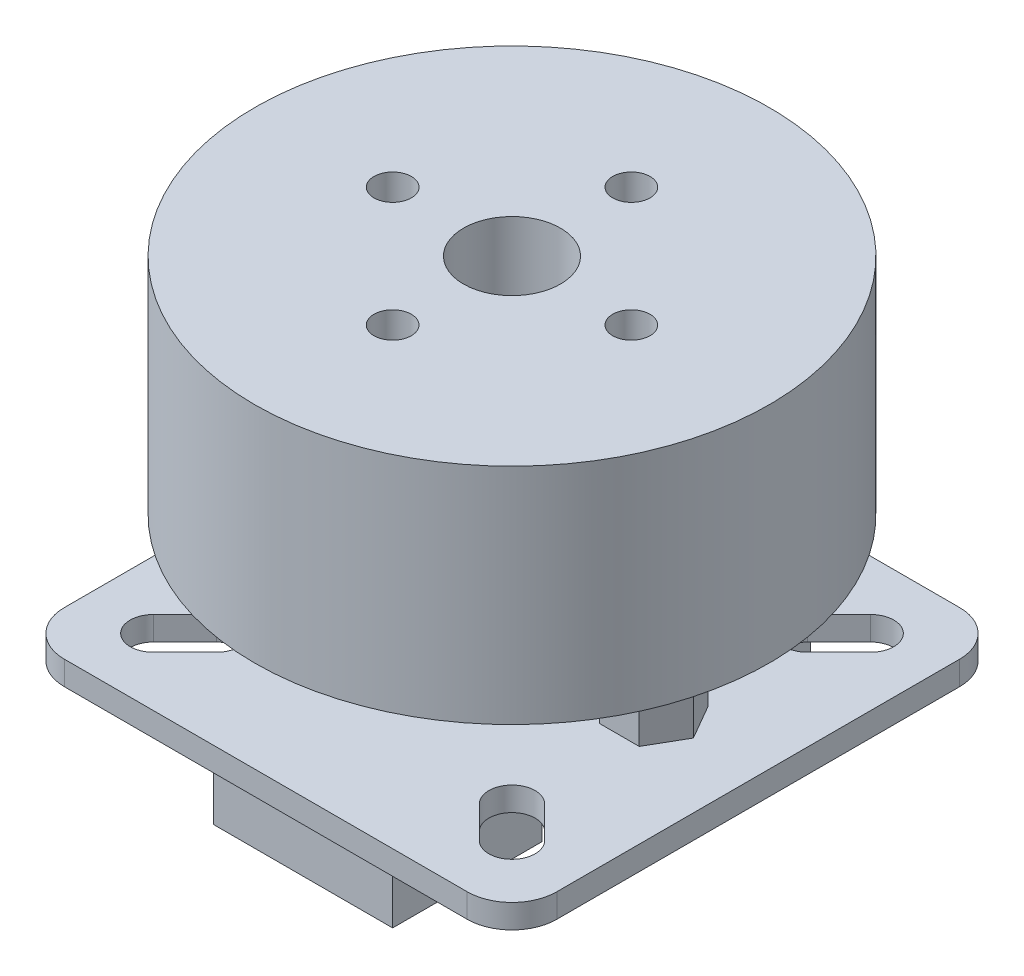
from build123d import *

# Parameters (mm, degrees)
SKETCH1_R           = 17.25
BOSS_EXTRUDE1_DEPTH = 15
SKETCH2_R           = 6
BOSS_EXTRUDE2_DEPTH = 4.5
BOSS_EXTRUDE3_DEPTH = 6.9
SKETCH4_W           = 33
SKETCH4_H           = 33
BOSS_EXTRUDE4_DEPTH = 1.6
FILLET1_R           = 3
SKETCH9_W           = 12
SKETCH9_H           = 10
BOSS_EXTRUDE6_DEPTH = 5.5
SKETCH10_R          = 1.25
CUT_EXTRUDE1_DEPTH  = 4
SKETCH11_R          = 3.1
BOSS_EXTRUDE7_DEPTH = 1.4
FILLET2_R           = 2
SKETCH12_R          = 3.25
CUT_EXTRUDE2_DEPTH  = 12


with BuildPart() as part:
    # Sketch1 → Boss-Extrude1 (new body)
    with BuildSketch(Plane(origin=(0, 0, 0), x_dir=(1, 0, 0), z_dir=(0, 1, 0))):
        with Locations(Location((0, 0, 0), (0, 0, 270))):
            Circle(SKETCH1_R)
    extrude(amount=BOSS_EXTRUDE1_DEPTH)

    # Sketch2 → Boss-Extrude2 (add)
    with BuildSketch(Plane.XZ):
        with Locations(Location((0, 0, 0), (0, 0, 270))):
            Circle(SKETCH2_R)
    extrude(amount=BOSS_EXTRUDE2_DEPTH)

    # Sketch3 → Boss-Extrude3 (add)
    with BuildSketch(Plane.XZ):
        Polygon((-6.844188762, 0), (-8.172094381, 2.3), (-10.827905619, 2.3), (-12.155811238, 0), (-10.827905619, -2.3), (-8.172094381, -2.3), align=None)
        Polygon((12.155811238, 0), (10.827905619, 2.3), (8.172094381, 2.3), (6.844188762, 0), (8.172094381, -2.3), (10.827905619, -2.3), align=None)
    extrude(amount=BOSS_EXTRUDE3_DEPTH)

    # Sketch4 → Boss-Extrude4 (add)
    with BuildSketch(Plane.XZ.offset(6.9)):
        Rectangle(SKETCH4_W, SKETCH4_H)
        with BuildLine():
            Line((-13.116830791, -10.924799769), (-10.995510447, -8.803479426))
            ThreePointArc((-10.995510447, -8.803479426), (-8.803479426, -8.803479426), (-8.803479426, -10.995510447))
            Line((-8.803479426, -10.995510447), (-10.924799769, -13.116830791))
            ThreePointArc((-10.924799769, -13.116830791), (-13.116830791, -13.116830791), (-13.116830791, -10.924799769))
        make_face(mode=Mode.SUBTRACT)
        with BuildLine():
            Line((-13.116830791, 10.924799769), (-10.995510447, 8.803479426))
            ThreePointArc((-10.995510447, 8.803479426), (-8.803479426, 8.803479426), (-8.803479426, 10.995510447))
            Line((-8.803479426, 10.995510447), (-10.924799769, 13.116830791))
            ThreePointArc((-10.924799769, 13.116830791), (-13.116830791, 13.116830791), (-13.116830791, 10.924799769))
        make_face(mode=Mode.SUBTRACT)
        with BuildLine():
            Line((13.116830791, -10.924799769), (10.995510447, -8.803479426))
            ThreePointArc((10.995510447, -8.803479426), (8.803479426, -8.803479426), (8.803479426, -10.995510447))
            Line((8.803479426, -10.995510447), (10.924799769, -13.116830791))
            ThreePointArc((10.924799769, -13.116830791), (13.116830791, -13.116830791), (13.116830791, -10.924799769))
        make_face(mode=Mode.SUBTRACT)
        with BuildLine():
            Line((13.116830791, 10.924799769), (10.995510447, 8.803479426))
            ThreePointArc((10.995510447, 8.803479426), (8.803479426, 8.803479426), (8.803479426, 10.995510447))
            Line((8.803479426, 10.995510447), (10.924799769, 13.116830791))
            ThreePointArc((10.924799769, 13.116830791), (13.116830791, 13.116830791), (13.116830791, 10.924799769))
        make_face(mode=Mode.SUBTRACT)
    extrude(amount=BOSS_EXTRUDE4_DEPTH)

    # Fillet1
    fillet1_edges = [part.edges().sort_by_distance(p)[0] for p in [
        (-16.5, -7.7, -16.5),
        (16.5, -7.7, -16.5),
        (16.5, -7.7, 16.5),
        (-16.5, -7.7, 16.5),
    ]]
    fillet(fillet1_edges, radius=FILLET1_R)

    # Sketch9 → Boss-Extrude6 (add)
    with BuildSketch(Plane.XZ.offset(8.5)):
        with Locations((0, 9)):
            Rectangle(SKETCH9_W, SKETCH9_H)
        with Locations((0, -9)):
            Rectangle(SKETCH9_W, SKETCH9_H)
    extrude(amount=BOSS_EXTRUDE6_DEPTH)

    # Sketch10 → Cut-Extrude1 (cut)
    with BuildSketch(Plane(origin=(0, 15, 0), x_dir=(1, 0, 0), z_dir=(0, 1, 0))):
        with Locations(Location((0, 8, 0), (0, 0, 270))):
            Circle(SKETCH10_R)
        with Locations(Location((8, 0, 0), (0, 0, 270))):
            Circle(SKETCH10_R)
        with Locations(Location((0, -8, 0), (0, 0, 270))):
            Circle(SKETCH10_R)
        with Locations(Location((-8, 0, 0), (0, 0, 270))):
            Circle(SKETCH10_R)
    extrude(amount=-CUT_EXTRUDE1_DEPTH, mode=Mode.SUBTRACT)

    # Sketch11 → Boss-Extrude7 (add)
    with BuildSketch(Plane.XZ.offset(8.5)):
        with Locations(Location((-9.5, 0, 0), (0, 0, 270))):
            Circle(SKETCH11_R)
        with Locations(Location((9.5, 0, 0), (0, 0, 270))):
            Circle(SKETCH11_R)
    extrude(amount=BOSS_EXTRUDE7_DEPTH)

    # Fillet2
    # the kernel refuses this fillet: 2 mm, written as the material it takes off along each edge
    with BuildSketch(Plane(origin=(-9.5, -9.9, 0), x_dir=(0, 0, -1), z_dir=(-1, 0, 0))) as fillet2_piece_1:
        with BuildLine():
            CenterArc((1.192121597, -2), FILLET2_R, 17.457603124, 72.542396876)
            Line((1.192121597, 0), (1.192121597, 0.04))
            Line((1.192121597, 0.04), (3.1, 0.04))
            Line((3.1, 0.04), (3.14, 0))
            ThreePointArc((3.14, 0), (3.14, -0.7), (3.138157568, -1.388))
            Line((3.138157568, -1.388), (3.1, -1.4))
        make_face()
    revolve(axis=Axis((-9.5, -9.9, 0), (0, -1, 0)), mode=Mode.SUBTRACT)
    with BuildSketch(Plane(origin=(9.5, -9.9, 0), x_dir=(0, 0, -1), z_dir=(-1, 0, 0))) as fillet2_piece_2:
        with BuildLine():
            CenterArc((1.192121597, -2), FILLET2_R, 17.457603124, 72.542396876)
            Line((1.192121597, 0), (1.192121597, 0.04))
            Line((1.192121597, 0.04), (3.1, 0.04))
            Line((3.1, 0.04), (3.14, 0))
            ThreePointArc((3.14, 0), (3.14, -0.7), (3.138157568, -1.388))
            Line((3.138157568, -1.388), (3.1, -1.4))
        make_face()
    revolve(axis=Axis((9.5, -9.9, 0), (0, -1, 0)), mode=Mode.SUBTRACT)

    # Sketch12 → Cut-Extrude2 (cut)
    with BuildSketch(Plane(origin=(0, 15, 0), x_dir=(1, 0, 0), z_dir=(0, 1, 0))):
        with Locations(Location((0, 0, 0), (0, 0, 270))):
            Circle(SKETCH12_R)
    extrude(amount=-CUT_EXTRUDE2_DEPTH, mode=Mode.SUBTRACT)


solid = part.part
